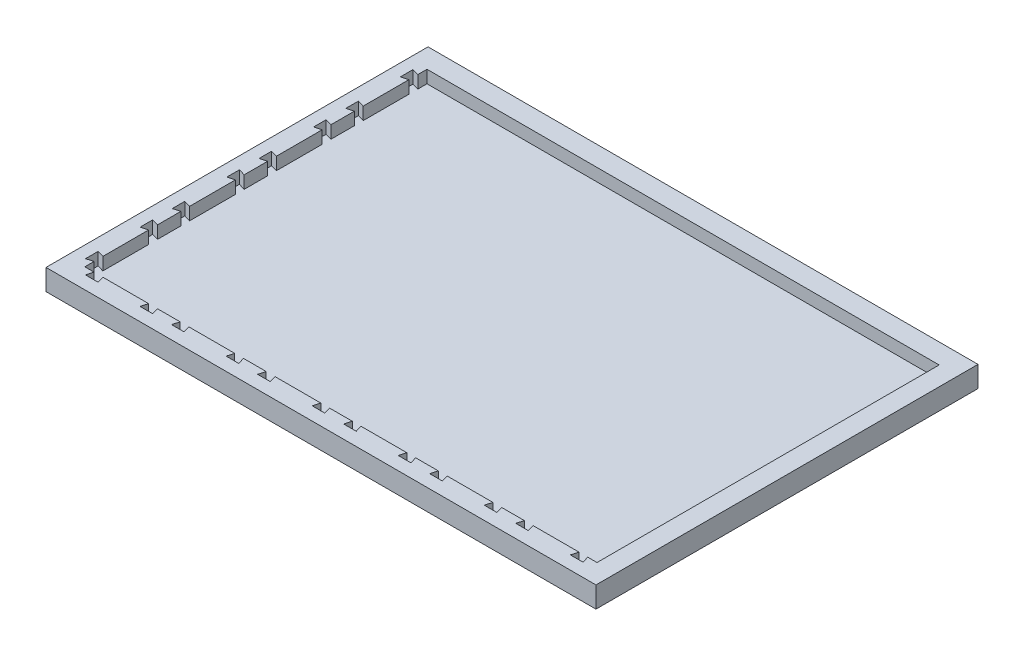
from build123d import *

# Parameters (mm, degrees)
SKETCH1_W           = 131
SKETCH1_H           = 91
BOSS_EXTRUDE1_DEPTH = 5
CUT_EXTRUDE2_DEPTH  = 3


with BuildPart() as part:
    # Sketch1 → Boss-Extrude1 (new body)
    with BuildSketch(Plane(origin=(0, 0, 0), x_dir=(1, 0, 0), z_dir=(0, 1, 0))):
        Rectangle(SKETCH1_W, SKETCH1_H)
    extrude(amount=BOSS_EXTRUDE1_DEPTH)

    # Sketch3 → Cut-Extrude2 (cut)
    with BuildSketch(Plane(origin=(0, 5, 0), x_dir=(1, 0, 0), z_dir=(0, 1, 0))):
        Polygon((-61, -38.55), (-61, -40.75), (-58.8, -40.75), (-59.25, -42.35), (-56.25, -42.35), (-56.7, -40.75), (-45.8, -40.75), (-46.25, -42.35), (-43.25, -42.35), (-43.7, -40.75), (-38.3, -40.75), (-38.75, -42.35), (-35.75, -42.35), (-36.2, -40.75), (-25.3, -40.75), (-25.75, -42.35), (-22.75, -42.35), (-23.2, -40.75), (-17.8, -40.75), (-18.25, -42.35), (-15.25, -42.35), (-15.7, -40.75), (-4.8, -40.75), (-5.25, -42.35), (-2.25, -42.35), (-2.7, -40.75), (2.7, -40.75), (2.25, -42.35), (5.25, -42.35), (4.8, -40.75), (15.7, -40.75), (15.25, -42.35), (18.25, -42.35), (17.8, -40.75), (23.2, -40.75), (22.75, -42.35), (25.75, -42.35), (25.3, -40.75), (36.2, -40.75), (35.75, -42.35), (38.75, -42.35), (38.3, -40.75), (43.7, -40.75), (43.25, -42.35), (46.25, -42.35), (45.8, -40.75), (56.7, -40.75), (56.25, -42.35), (59.25, -42.35), (58.8, -40.75), (61, -40.75), (61, 40.75), (-61, 40.75), (-61, 38.55), (-62.6, 39), (-62.6, 36), (-61, 36.45), (-61, 25.55), (-62.6, 26), (-62.6, 23), (-61, 23.45), (-61, 17.883333333), (-62.6, 18.333333333), (-62.6, 15.333333333), (-61, 15.783333333), (-61, 4.883333333), (-62.6, 5.333333333), (-62.6, 2.333333333), (-61, 2.783333333), (-61, -2.783333333), (-62.6, -2.333333333), (-62.6, -5.333333333), (-61, -4.883333333), (-61, -15.783333333), (-62.6, -15.333333333), (-62.6, -18.333333333), (-61, -17.883333333), (-61, -23.45), (-62.6, -23), (-62.6, -26), (-61, -25.55), (-61, -36.45), (-62.6, -36), (-62.6, -39), align=None)
    extrude(amount=-CUT_EXTRUDE2_DEPTH, mode=Mode.SUBTRACT)


solid = part.part
